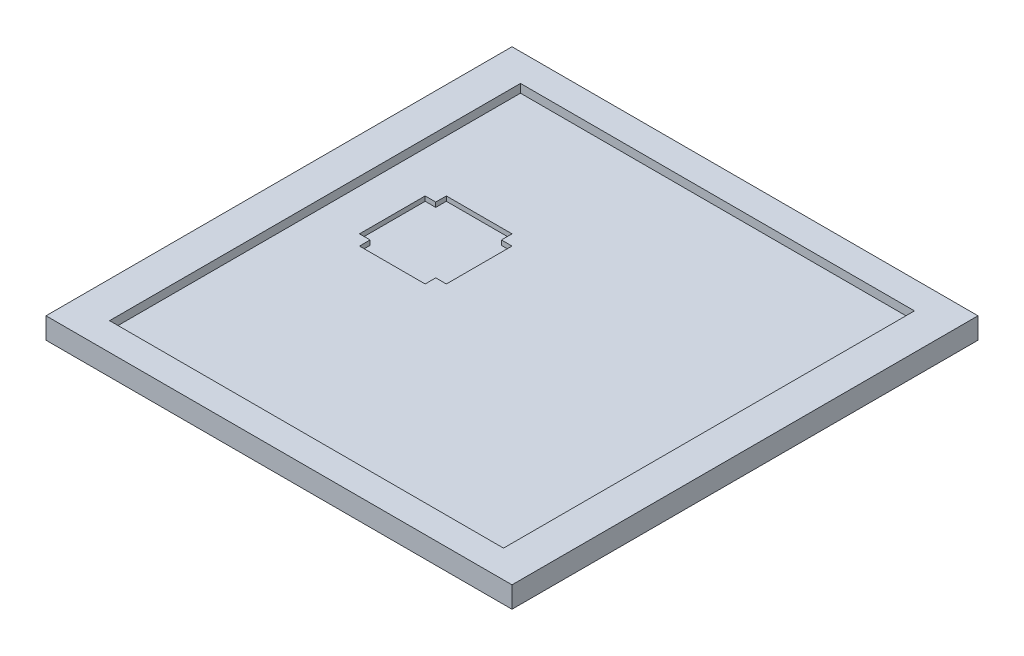
from build123d import *

# Parameters (mm, degrees)
SKETCH1_W           = 110
SKETCH1_H           = 110
BOSS_EXTRUDE1_DEPTH = 5
SKETCH2_W           = 93
SKETCH2_H           = 97
CUT_EXTRUDE1_DEPTH  = 2
CUT_EXTRUDE2_DEPTH  = 1.1


with BuildPart() as part:
    # Sketch1 → Boss-Extrude1 (new body)
    with BuildSketch(Plane(origin=(0, 0, 0), x_dir=(1, 0, 0), z_dir=(0, 1, 0))):
        with Locations((-13.863013699, -16.650684932)):
            Rectangle(SKETCH1_W, SKETCH1_H)
    extrude(amount=BOSS_EXTRUDE1_DEPTH)

    # Sketch2 → Cut-Extrude1 (cut)
    with BuildSketch(Plane(origin=(0, 5, 0), x_dir=(1, 0, 0), z_dir=(0, 1, 0))):
        with Locations((-13.863013699, -16.650684932)):
            Rectangle(SKETCH2_W, SKETCH2_H)
    extrude(amount=-CUT_EXTRUDE1_DEPTH, mode=Mode.SUBTRACT)

    # Sketch3 → Cut-Extrude2 (cut)
    with BuildSketch(Plane(origin=(0, 3, 0), x_dir=(1, 0, 0), z_dir=(0, 1, 0))):
        Polygon((-30.113013699, -0.400684932), (-32.613013699, -0.400684932), (-32.613013699, 2.099315068), (-48.113013699, 2.099315068), (-48.113013699, -0.400684932), (-50.613013699, -0.400684932), (-50.613013699, -15.900684932), (-48.113013699, -15.900684932), (-48.113013699, -18.400684932), (-32.613013699, -18.400684932), (-32.613013699, -15.900684932), (-30.113013699, -15.900684932), align=None)
    extrude(amount=-CUT_EXTRUDE2_DEPTH, mode=Mode.SUBTRACT)


solid = part.part
